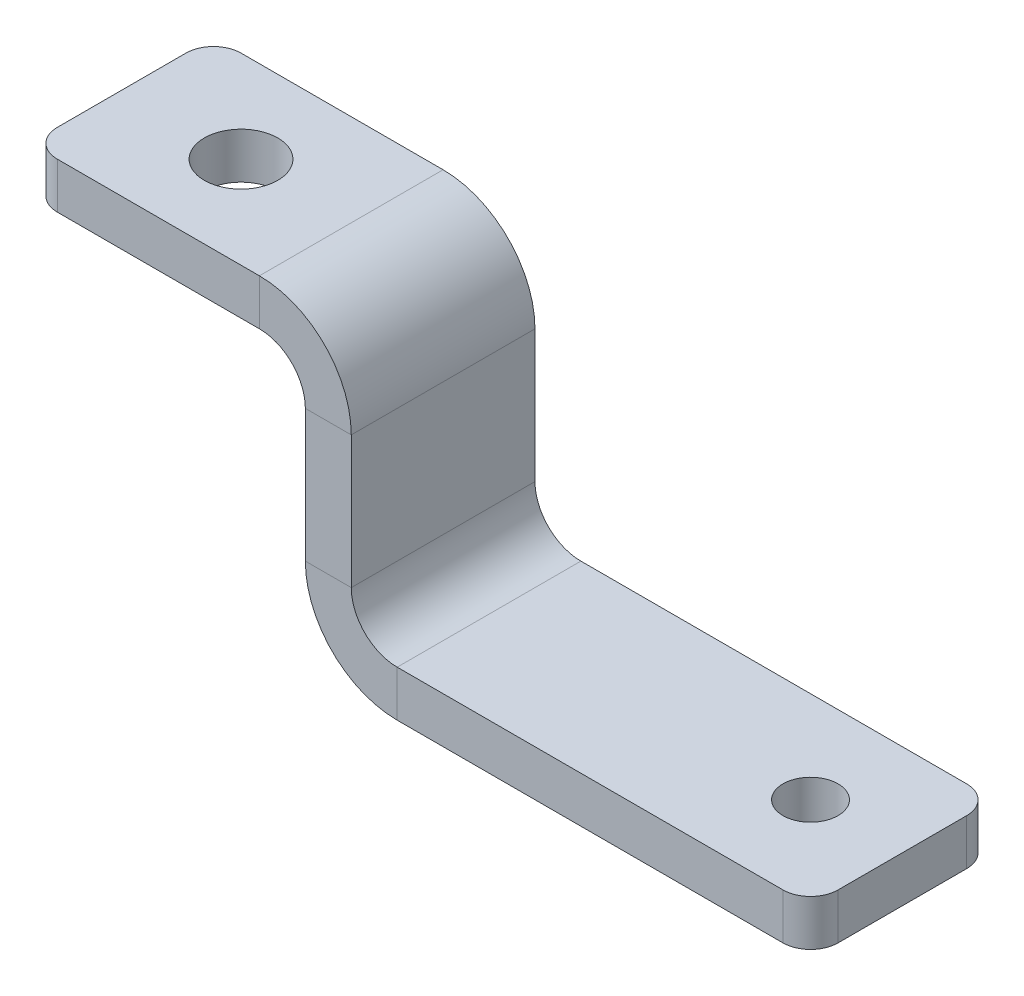
from build123d import *

# Parameters (mm, degrees)
SKETCH1_R          = 3
BASE_FLANGE1_DEPTH = 5
EDGE_FLANGE1_DEPTH = 20
EDGE_FLANGE2_DEPTH = 20
SKETCH15_R         = 4
CUT_EXTRUDE1_DEPTH = 5
CUT_EXTRUDE2_DEPTH = 5


# Sheet-metal steps are written as plain solids
with BuildPart() as part:
    # Sketch1 → Base-Flange1 (new body)
    with BuildSketch(Plane(origin=(0, 0, 0), x_dir=(1, 0, 0), z_dir=(0, 1, 0))):
        with BuildLine():
            Line((-35, 10), (7, 10))
            ThreePointArc((7, 10), (9.121320344, 9.121320344), (10, 7))
            Line((10, 7), (10, -7))
            ThreePointArc((10, -7), (9.121320344, -9.121320344), (7, -10))
            Line((7, -10), (-35, -10))
            Line((-35, -10), (-35, 10))
        make_face()
        with Locations(Location((0, 0, 0), (0, 0, 270))):
            Circle(SKETCH1_R, mode=Mode.SUBTRACT)
    extrude(amount=-BASE_FLANGE1_DEPTH)

    # Edge-Flange1 section (across the edge) → Edge-Flange1 (add)
    with BuildSketch(Plane(origin=(-40, 0, -10), x_dir=(1, 0, 0), z_dir=(0, 0, 1))):
        with BuildLine():
            Line((-5, 5), (-5, 19.4))
            Line((-5, 19.4), (0, 19.4))
            Line((0, 19.4), (0, 5))
            ThreePointArc((0, 5), (1.464466094, 1.464466094), (5, 0))
            Line((5, 0), (5, -5))
            ThreePointArc((5, -5), (-2.071067812, -2.071067812), (-5, 5))
        make_face()
    extrude(amount=EDGE_FLANGE1_DEPTH)

    # Edge-Flange2 section (across the edge) → Edge-Flange2 (add)
    with BuildSketch(Plane(origin=(-45, 24.4, 10), x_dir=(0, -1, 0), z_dir=(0, 0, -1))):
        with BuildLine():
            Line((-5, 5), (-5, 30))
            Line((-5, 30), (0, 30))
            Line((0, 30), (0, 5))
            ThreePointArc((0, 5), (1.464466094, 1.464466094), (5, 0))
            Line((5, 0), (5, -5))
            ThreePointArc((5, -5), (-2.071067812, -2.071067812), (-5, 5))
        make_face()
    extrude(amount=EDGE_FLANGE2_DEPTH)

    # Sketch15 → Cut-Extrude1 (cut)
    with BuildSketch(Plane(origin=(0, 29.4, 0), x_dir=(1, 0, 0), z_dir=(0, 1, 0))):
        with Locations(Location((-62, 0, 0), (0, 0, 180))):
            Circle(SKETCH15_R)
    extrude(amount=-CUT_EXTRUDE1_DEPTH, mode=Mode.SUBTRACT)

    # Sketch16 → Cut-Extrude2 (cut)
    with BuildSketch(Plane(origin=(0, 29.4, 0), x_dir=(1, 0, 0), z_dir=(0, 1, 0))):
        with BuildLine():
            Line((-75, 7), (-75, 10))
            Line((-75, 10), (-72, 10))
            ThreePointArc((-72, 10), (-74.121320344, 9.121320344), (-75, 7))
        make_face()
        with BuildLine():
            Line((-75, -7), (-75, -10))
            Line((-75, -10), (-72, -10))
            ThreePointArc((-72, -10), (-74.121320344, -9.121320344), (-75, -7))
        make_face()
    extrude(amount=-CUT_EXTRUDE2_DEPTH, mode=Mode.SUBTRACT)


solid = part.part
